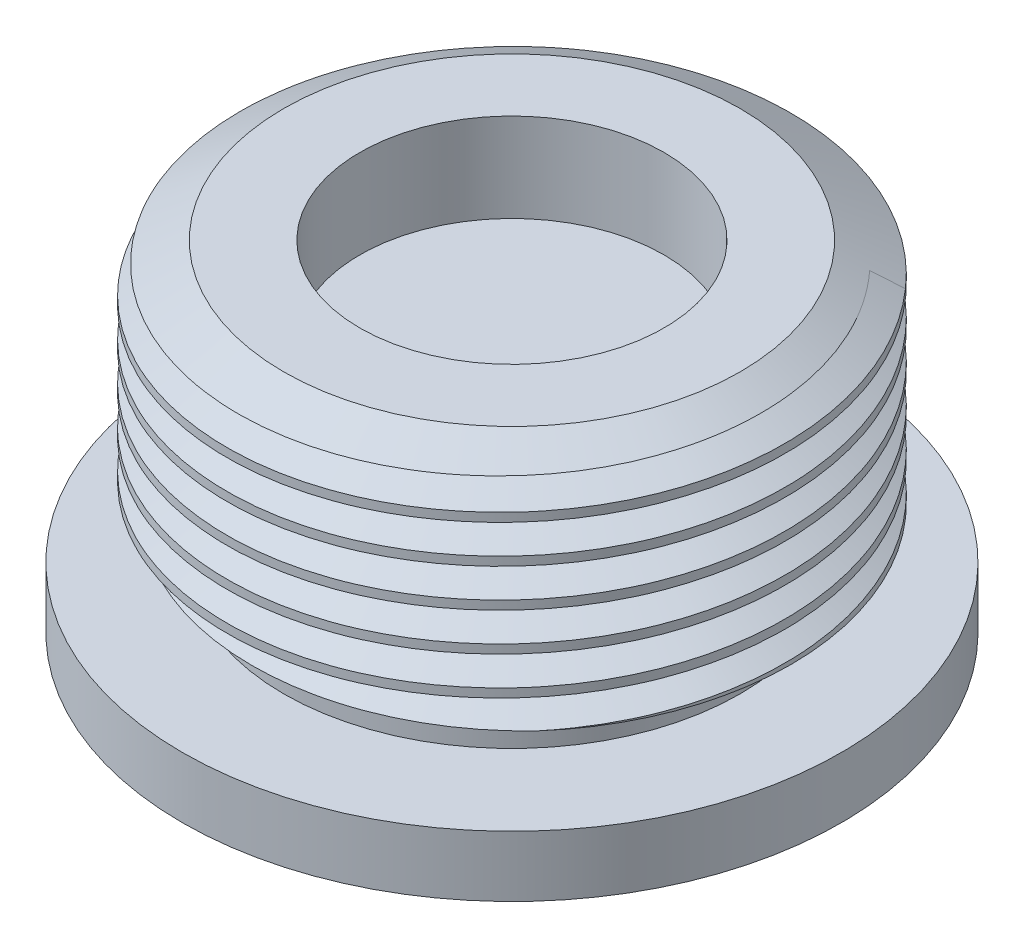
from build123d import *

# Parameters (mm, degrees)
CROQUIS1_R              = 13
SALIENTE_EXTRUIR1_DEPTH = 2.4
CROQUIS2_R              = 9
SALIENTE_EXTRUIR2_DEPTH = 2
CROQUIS3_R              = 11
SALIENTE_EXTRUIR3_DEPTH = 9
CORTAR_BARRER1_PITCH    = 1.5
CORTAR_BARRER1_TO       = 9
CROQUIS7_R              = 6
CORTAR_EXTRUIR1_DEPTH   = 3.5
CORTAR_EXTRUIR2_DEPTH   = 6


with BuildPart() as part:
    # Croquis1 → Saliente-Extruir1 (new body)
    with BuildSketch(Plane(origin=(0, 0, 0), x_dir=(1, 0, 0), z_dir=(0, 1, 0))):
        with Locations(Location((0, 0, 0), (0, 0, 270))):
            Circle(CROQUIS1_R)
    extrude(amount=SALIENTE_EXTRUIR1_DEPTH)

    # Croquis2 → Saliente-Extruir2 (add)
    with BuildSketch(Plane(origin=(0, 2.4, 0), x_dir=(1, 0, 0), z_dir=(0, 1, 0))):
        with Locations(Location((0, 0, 0), (0, 0, 270))):
            Circle(CROQUIS2_R)
    extrude(amount=SALIENTE_EXTRUIR2_DEPTH)

    # Croquis3 → Saliente-Extruir3 (add)
    with BuildSketch(Plane(origin=(0, 4.4, 0), x_dir=(1, 0, 0), z_dir=(0, 1, 0))):
        with Locations(Location((0, 0, 0), (0, 0, 270))):
            Circle(CROQUIS3_R)
    extrude(amount=SALIENTE_EXTRUIR3_DEPTH)

    # Cortar-Barrer1: arcs per turn and ends read off the stored shape
    # Cortar-Barrer1: the profile of Croquis6 screwed along a right-hand helix through 8 turns, 8 arcs to a turn; built about Z, then put on its axis
    cortar_barrer1_z = Axis((0, 0, 0), (0, 0, 1))
    cortar_barrer1_corners = [(10, 0, -1.5), (11.5, 0, -2.366025404), (11.5, 0, -0.633974596)]
    with BuildLine(mode=Mode.PRIVATE) as cortar_barrer1_profile:
        Line(cortar_barrer1_corners[0], cortar_barrer1_corners[1])
        Line(cortar_barrer1_corners[1], cortar_barrer1_corners[2])
        Line(cortar_barrer1_corners[2], cortar_barrer1_corners[0])
    cortar_barrer1_cap = Face(cortar_barrer1_profile.wire())
    cortar_barrer1_turn_angles = [0, 22.5, 45, 67.5, 90, 112.5, 135, 157.5, 180, 202.5, 225, 247.5, 270, 292.5, 315, 337.5, 360]
    cortar_barrer1_turn_weights = [1, 0.9238795325112867, 1, 0.9238795325112867, 1, 0.9238795325112867, 1, 0.9238795325112867, 1, 0.9238795325112867, 1, 0.9238795325112867, 1, 0.9238795325112867, 1, 0.9238795325112867, 1]
    cortar_barrer1_turn_rails = [Edge.make_bspline([Vector(p[0], p[1], 0).rotate(cortar_barrer1_z, cortar_barrer1_turn_angles[k]) / cortar_barrer1_turn_weights[k] + Vector(0, 0, p[2] + CORTAR_BARRER1_PITCH * cortar_barrer1_turn_angles[k] / 360) for k in range(17)], [0, 0, 0, 1, 1, 2, 2, 3, 3, 4, 4, 5, 5, 6, 6, 7, 7, 8, 8, 8], 2, cortar_barrer1_turn_weights) for p in cortar_barrer1_corners]
    cortar_barrer1_turn_sides = [Face.make_surface_from_curves(cortar_barrer1_turn_rails[p[0]], cortar_barrer1_turn_rails[p[1]]) for p in [(0, 1), (1, 2), (2, 0)]]
    cortar_barrer1_turn = Solid(Shell([*cortar_barrer1_turn_sides, cortar_barrer1_cap, cortar_barrer1_cap.rotate(cortar_barrer1_z, 360).moved(Location((0, 0, CORTAR_BARRER1_PITCH * 360 / 360)))]))
    cortar_barrer1_each = [*[cortar_barrer1_turn.moved(Location((0, 0, CORTAR_BARRER1_PITCH * i))) for i in range(8)]]
    add(Plane(origin=(0, 13.4, 0), x_dir=(-1, 0, 0), z_dir=(0, -1, 0)) * split(Compound([cortar_barrer1_each[i] for i in range(0, 8, 2)]), bisect_by=Plane.XY.offset(CORTAR_BARRER1_TO), keep=Keep.BOTTOM, mode=Mode.PRIVATE), mode=Mode.SUBTRACT)
    add(Plane(origin=(0, 13.4, 0), x_dir=(-1, 0, 0), z_dir=(0, -1, 0)) * split(Compound([cortar_barrer1_each[i] for i in range(1, 8, 2)]), bisect_by=Plane.XY.offset(CORTAR_BARRER1_TO), keep=Keep.BOTTOM, mode=Mode.PRIVATE), mode=Mode.SUBTRACT)

    # Croquis7 → Cortar-Extruir1 (cut)
    with BuildSketch(Plane(origin=(0, 13.4, 0), x_dir=(1, 0, 0), z_dir=(0, 1, 0))):
        with Locations(Location((0, 0, 0), (0, 0, 270))):
            Circle(CROQUIS7_R)
    extrude(amount=-CORTAR_EXTRUIR1_DEPTH, mode=Mode.SUBTRACT)

    # Croquis8 → Cortar-Extruir2 (cut)
    with BuildSketch(Plane.XZ):
        Polygon((4.329568801, 0), (3.061467459, 3.061467459), (0, 4.329568801), (-3.061467459, 3.061467459), (-4.329568801, 0), (-3.061467459, -3.061467459), (0, -4.329568801), (3.061467459, -3.061467459), align=None)
    extrude(amount=-CORTAR_EXTRUIR2_DEPTH, mode=Mode.SUBTRACT)

    # Cortar-Barrer3: sweep along a path in Croquis12
    with BuildLine(Plane(origin=(0, 13.4, 0), x_dir=(1, 0, 0), z_dir=(0, 1, 0))) as cortar_barrer3_path:
        CenterArc((0, 0), 11, 0, 360)
    # Croquis11 → Cortar-Barrer3 (sweep, cut)
    with BuildSketch(Plane.XY):
        Polygon((9, 13.4), (12, 11.667949192), (12, 15.132050808), align=None)
    sweep(path=cortar_barrer3_path.line, mode=Mode.SUBTRACT)

    # Cortar-Barrer4: sweep along a path in Croquis10
    with BuildLine(Plane.XZ) as cortar_barrer4_path:
        CenterArc((0, 0), 4.329568801, 0, 360)
    # Croquis13 → Cortar-Barrer4 (sweep, cut)
    with BuildSketch(Plane.XY):
        Polygon((-4.306506597, 0), (-3.856506597, -0.259807621), (-3.856506597, 0.259807621), align=None)
    sweep(path=cortar_barrer4_path.line, mode=Mode.SUBTRACT)


solid = part.part
